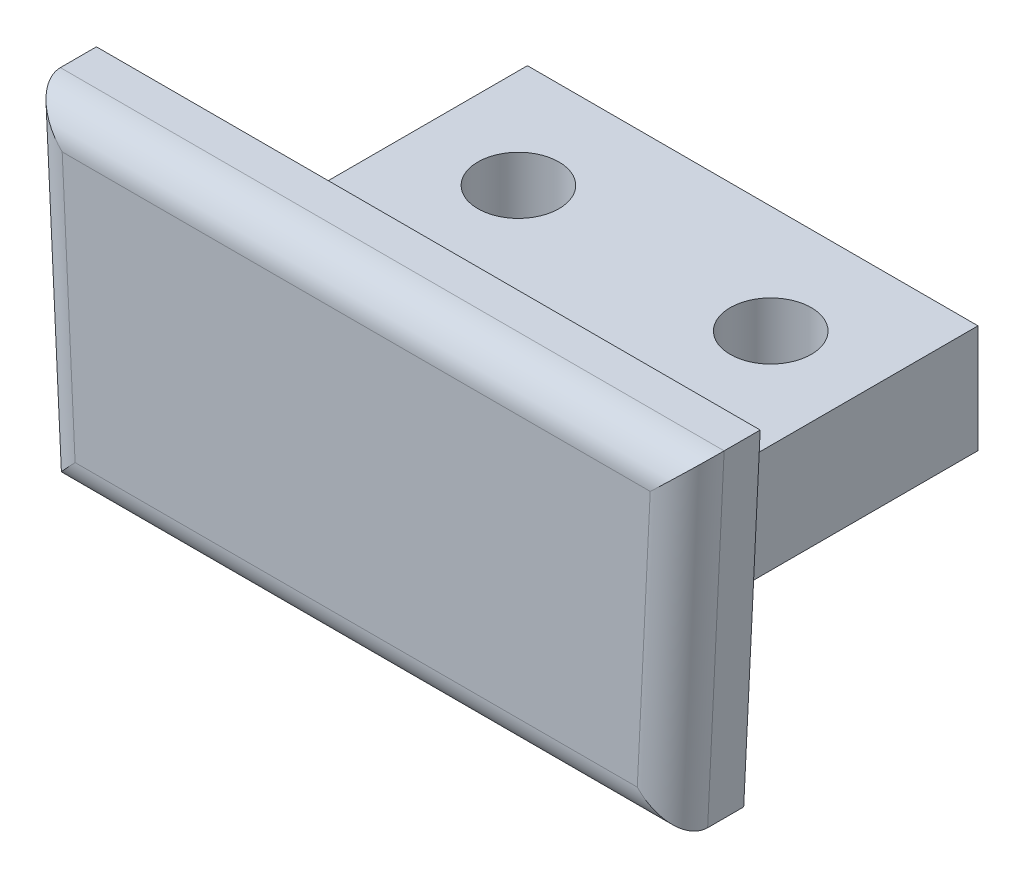
from build123d import *

# Parameters (mm, degrees)
SKETCH1_W           = 25
SKETCH1_H           = 23
BOSS_EXTRUDE1_DEPTH = 6
BOSS_EXTRUDE3_DEPTH = 4
FILLET1_R           = 2
SKETCH2_R           = 2.25
CUT_EXTRUDE1_DEPTH  = 6
SKETCH9_W           = 25
SKETCH9_H           = 6
CUT_EXTRUDE2_DEPTH  = 1


with BuildPart() as part:
    # Sketch1 → Boss-Extrude1 (new body)
    with BuildSketch(Plane(origin=(0, 0, 0), x_dir=(1, 0, 0), z_dir=(0, 1, 0))):
        with Locations((12.5, 11.5)):
            Rectangle(SKETCH1_W, SKETCH1_H)
    extrude(amount=BOSS_EXTRUDE1_DEPTH)

    # Sketch5 → Boss-Extrude3 (add)
    with BuildSketch(Plane.XY):
        Polygon((-5.91332664, 12.95), (30.915, 12.95), (30, -5.62), (-5, -5.62), align=None)
    extrude(amount=-BOSS_EXTRUDE3_DEPTH)

    # Fillet1
    fillet1_edges = [part.edges().sort_by_distance(p)[0] for p in [
        (12.50083668, 12.95, 0),
        (30.4575, 3.665, 0),
        (-5.45666332, 3.665, 0),
        (12.5, -5.62, 0),
    ]]
    fillet(fillet1_edges, radius=FILLET1_R)

    # Sketch2 → Cut-Extrude1 (cut)
    with BuildSketch(Plane.XZ):
        with Locations((5.5, -16)):
            Circle(SKETCH2_R)
        with Locations((19.5, -16)):
            Circle(SKETCH2_R)
    extrude(amount=-CUT_EXTRUDE1_DEPTH, mode=Mode.SUBTRACT)

    # Sketch9 → Cut-Extrude2 (cut)
    with BuildSketch(Plane(origin=(0, 0, -23), x_dir=(-1, 0, 0), z_dir=(0, 0, -1))):
        with Locations((-12.5, 3)):
            Rectangle(SKETCH9_W, SKETCH9_H)
    extrude(amount=-CUT_EXTRUDE2_DEPTH, mode=Mode.SUBTRACT)


solid = part.part
